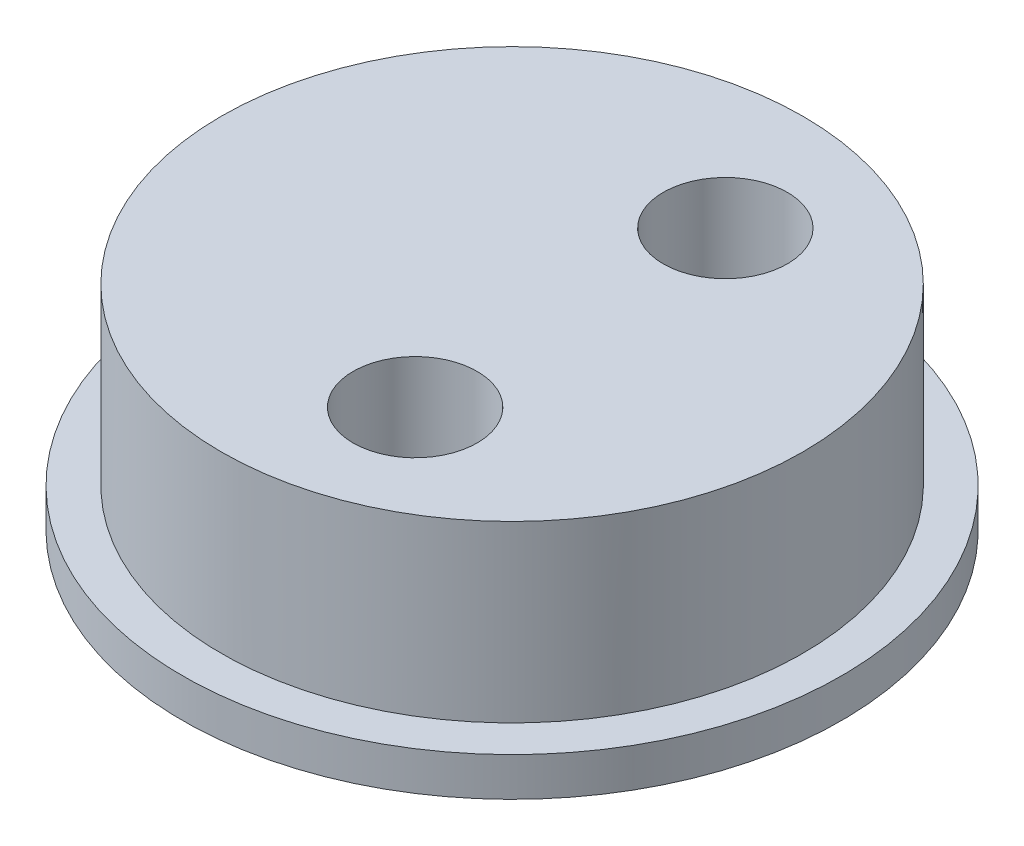
from build123d import *

# Parameters (mm, degrees)
SKETCH1_R           = 7.5
BOSS_EXTRUDE1_DEPTH = 5.5
SKETCH2_R           = 8.5
BOSS_EXTRUDE2_DEPTH = 1
SKETCH4_R           = 1.6
CUT_EXTRUDE1_DEPTH  = 15.230249471


with BuildPart() as part:
    # Sketch1 → Boss-Extrude1 (new body)
    with BuildSketch(Plane(origin=(0, 0, 0), x_dir=(1, 0, 0), z_dir=(0, 1, 0))):
        with Locations((-1.5, 0)):
            Circle(SKETCH1_R)
    extrude(amount=BOSS_EXTRUDE1_DEPTH)

    # Sketch2 → Boss-Extrude2 (add)
    with BuildSketch(Plane.XZ):
        with Locations((-1.5, 0)):
            Circle(SKETCH2_R)
    extrude(amount=-BOSS_EXTRUDE2_DEPTH)

    # Sketch4 → Cut-Extrude1 (cut, through all)
    with BuildSketch(Plane(origin=(0, 5.5, 0), x_dir=(1, 0, 0), z_dir=(0, 1, 0))):
        with Locations((0, 4)):
            Circle(SKETCH4_R)
        with Locations((0, -4)):
            Circle(SKETCH4_R)
    extrude(amount=-CUT_EXTRUDE1_DEPTH, mode=Mode.SUBTRACT)


solid = part.part
